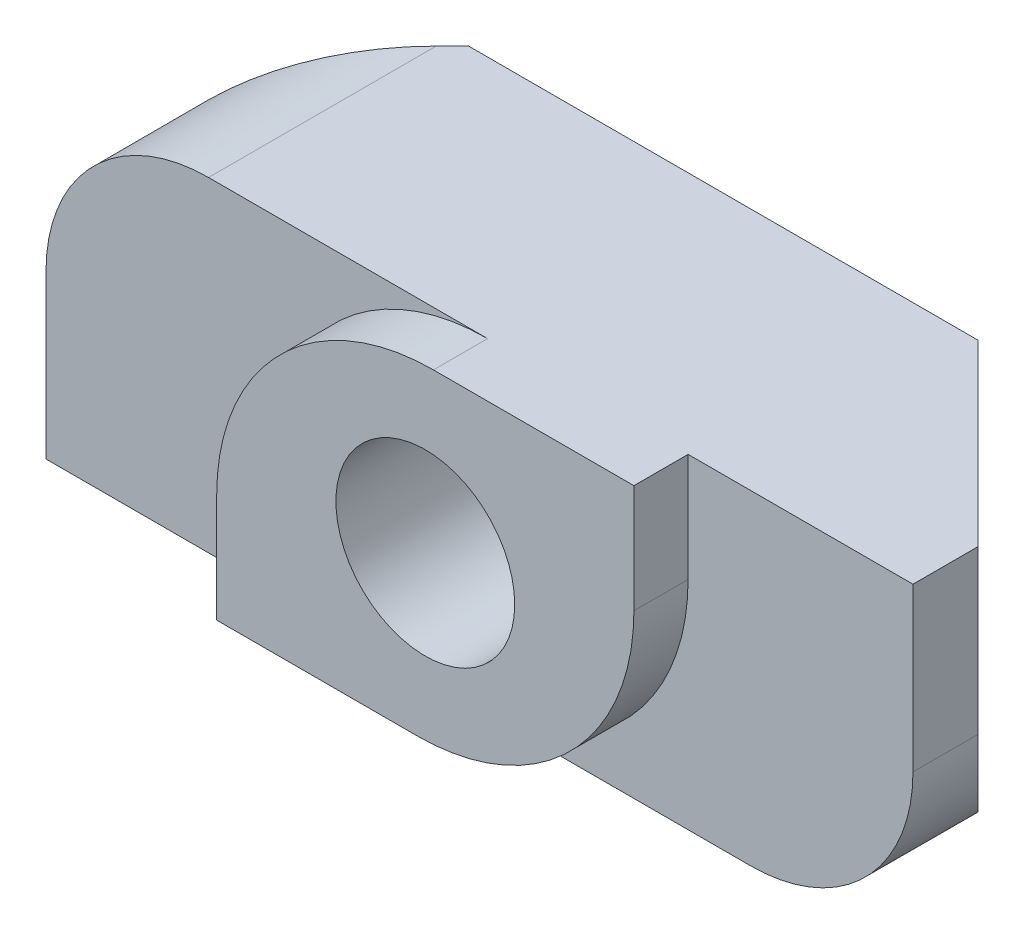
from build123d import *

# Parameters (mm, degrees)
BOSS_EXTRUDE1_DEPTH = 6
SKETCH2_R           = 1.65
CUT_EXTRUDE1_DEPTH  = 12.412712211
FILLET1_R           = 4
FILLET2_R           = 3


with BuildPart() as part:
    # Sketch1 → Boss-Extrude1 (new body)
    with BuildSketch(Plane(origin=(0, 0, 0), x_dir=(1, 0, 0), z_dir=(0, 1, 0))):
        Polygon((4.7, 0), (-4.7, 0), (-8, -3.3), (-8, -4.5), (-3.85, -4.5), (-3.85, -5.5), (3.85, -5.5), (3.85, -4.5), (8, -4.5), (8, -3.3), align=None)
    extrude(amount=BOSS_EXTRUDE1_DEPTH)

    # Sketch2 → Cut-Extrude1 (cut, through all)
    with BuildSketch(Plane.XY.offset(5.5)):
        with Locations((0, 3)):
            Circle(SKETCH2_R)
    extrude(amount=-CUT_EXTRUDE1_DEPTH, mode=Mode.SUBTRACT)

    # Fillet1
    fillet1_edges = [part.edges().sort_by_distance(p)[0] for p in [
        (-3.85, 6, 5),
        (3.85, 0, 5),
    ]]
    fillet(fillet1_edges, radius=FILLET1_R)

    # Fillet2
    fillet2_edges = [part.edges().sort_by_distance(p)[0] for p in [
        (-8, 6, 3.9),
        (8, 0, 3.9),
    ]]
    fillet(fillet2_edges, radius=FILLET2_R)


solid = part.part
